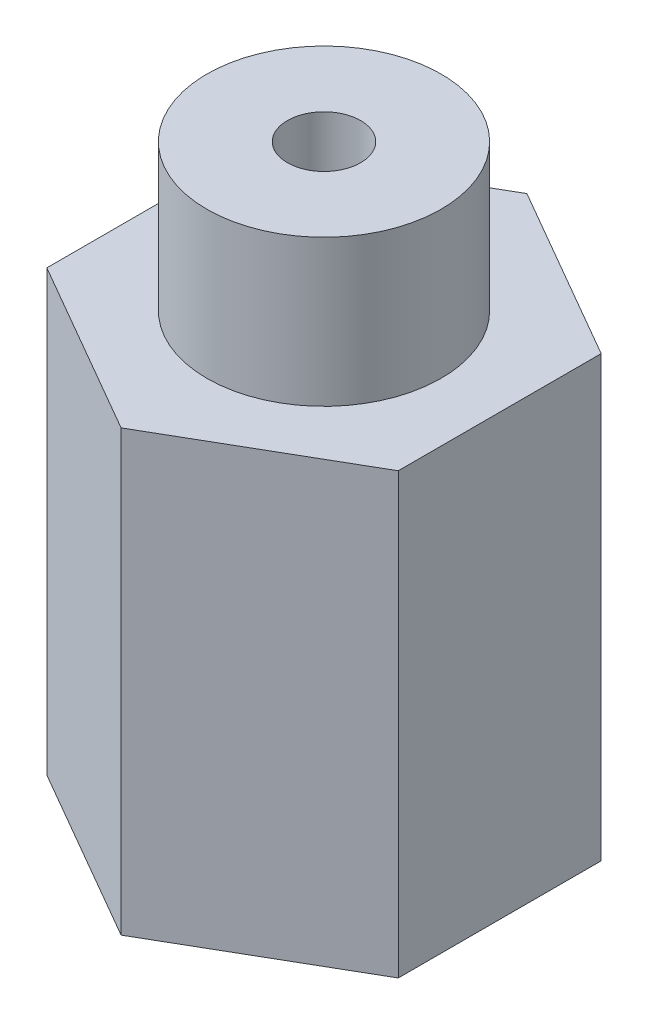
from build123d import *

# Parameters (mm, degrees)
EXTRUDE_1_DEPTH     = 40
SKETCH_3_R          = 2.5
CUT_EXTRUDE_2_DEPTH = 35
SKETCH_4_OUTSIDE_W  = 36.852
SKETCH_4_OUTSIDE_H  = 40.564
SKETCH_4_OUTSIDE_R  = 8
CUT_EXTRUDE_3_DEPTH = 10
SKETCH_5_R          = 5
CUT_EXTRUDE_4_DEPTH = 15


with BuildPart() as part:
    # Эскиз1 → Бобышка-Вытянуть1 (new body)
    with BuildSketch(Plane(origin=(0, 0, 0), x_dir=(1, 0, 0), z_dir=(0, 1, 0))):
        Polygon((0, 13.856406461), (-12, 6.92820323), (-12, -6.92820323), (0, -13.856406461), (12, -6.92820323), (12, 6.92820323), align=None)
    extrude(amount=EXTRUDE_1_DEPTH)

    # Эскиз3 → Вырез-Вытянуть2 (cut)
    with BuildSketch(Plane(origin=(0, 40, 0), x_dir=(1, 0, 0), z_dir=(0, 1, 0))):
        Circle(SKETCH_3_R)
    extrude(amount=-CUT_EXTRUDE_2_DEPTH, mode=Mode.SUBTRACT)

    # Эскиз4 outside → Вырез-Вытянуть3 (cut)
    with BuildSketch(Plane(origin=(0, 40, 0), x_dir=(1, 0, 0), z_dir=(0, 1, 0))):
        Rectangle(SKETCH_4_OUTSIDE_W, SKETCH_4_OUTSIDE_H)
        Circle(SKETCH_4_OUTSIDE_R, mode=Mode.SUBTRACT)
    extrude(amount=-CUT_EXTRUDE_3_DEPTH, mode=Mode.SUBTRACT)

    # Эскиз5 → Вырез-Вытянуть4 (cut)
    with BuildSketch(Plane(origin=(-6, 0, -10.392304845), x_dir=(-0.8660254037844386, 0, 0.5000000000000002), z_dir=(-0.5000000000000001, 0, -0.8660254037844385))):
        with Locations((0, 8)):
            Circle(SKETCH_5_R)
    extrude(amount=-CUT_EXTRUDE_4_DEPTH, mode=Mode.SUBTRACT)


solid = part.part
